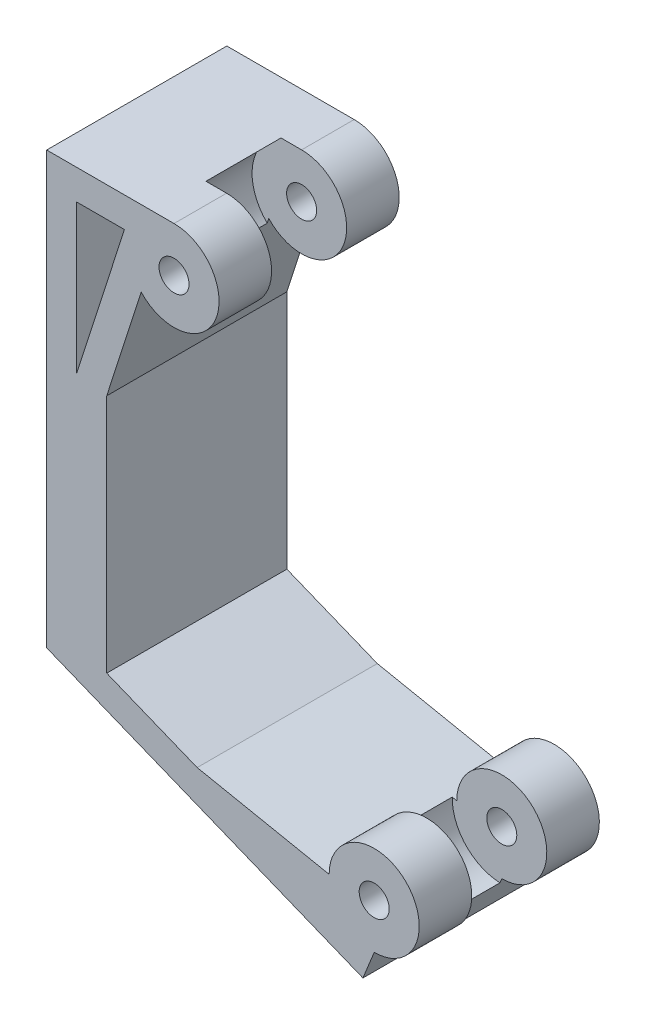
from build123d import *

# Parameters (mm, degrees)
SKETCH1_R               = 1
BOSS_EXTRUDE1_DEPTH     = 12
CUT_EXTRUDE1_DEPTH      = 2.5
CUT_EXTRUDE1_DEPTH_BACK = 2.5
SKETCH2_R               = 3.3


with BuildPart() as part:
    # Sketch1 → Boss-Extrude1 (new body)
    with BuildSketch(Plane.XY):
        with BuildLine():
            Line((0, 6.657714091), (0, 35.381865278))
            Line((0, 35.381865278), (8.483562347, 35.381865278))
            ThreePointArc((8.483562347, 35.381865278), (11.237097985, 31.191049803), (6.297593783, 30.327226275))
            Line((6.297593783, 30.327226275), (4, 23.200108131))
            Line((4, 23.200108131), (4, 7.198678673))
            Line((4, 7.198678673), (10.025060876, 4.764396067))
            Line((10.025060876, 4.764396067), (18.817354946, 3))
            ThreePointArc((18.817354946, 3), (23.938675289, 5.121320344), (21.817354946, 0))
            Line((21.817354946, 0), (21.068141759, -1.854367709))
            Line((21.068141759, -1.854367709), (0, 6.657714091))
        make_face()
        with Locations((8.483562347, 32.381865278)):
            Circle(SKETCH1_R, mode=Mode.SUBTRACT)
        with Locations((21.817354946, 3)):
            Circle(SKETCH1_R, mode=Mode.SUBTRACT)
        Polygon((5.180971974, 33.381865278), (2, 33.381865278), (2, 23.514514817), align=None, mode=Mode.SUBTRACT)
    extrude(amount=BOSS_EXTRUDE1_DEPTH)

    # Sketch2 → Cut-Extrude1 (cut, two sides: drawn at the far end of the back side and taken through both)
    with BuildSketch(Plane.XY.offset(6).offset(-CUT_EXTRUDE1_DEPTH_BACK)):
        with Locations((8.483562347, 32.381865278)):
            Circle(SKETCH2_R)
        with Locations((21.817354946, 3)):
            Circle(SKETCH2_R)
    extrude(amount=CUT_EXTRUDE1_DEPTH + CUT_EXTRUDE1_DEPTH_BACK, mode=Mode.SUBTRACT)


solid = part.part
